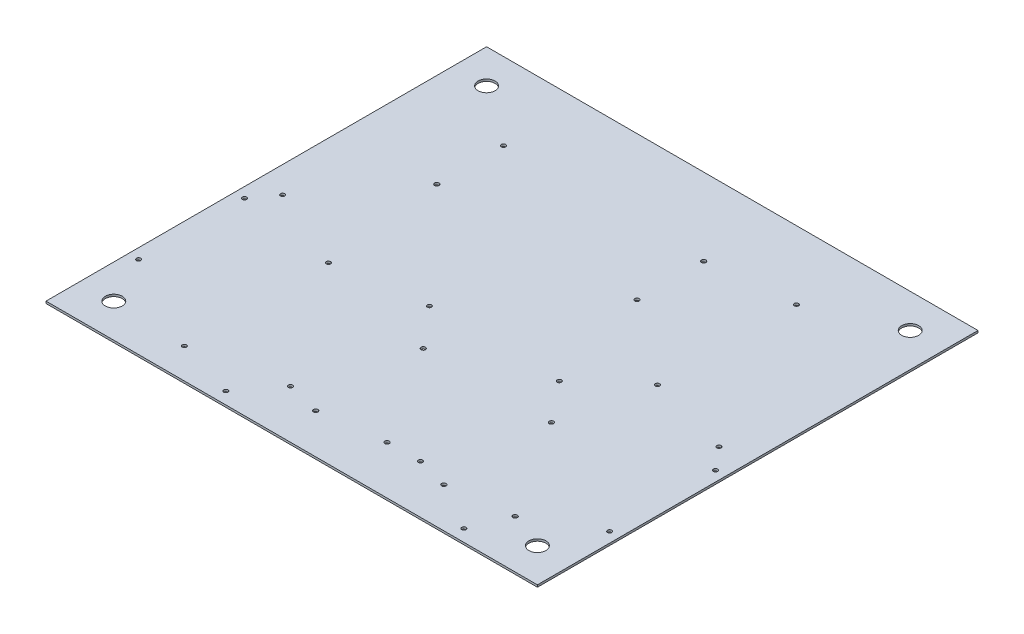
from build123d import *

# Parameters (mm, degrees)
SKETCH1_W           = 368.3
SKETCH1_H           = 330.2
BOSS_EXTRUDE1_DEPTH = 1.5875
CUT_EXTRUDE1_REACH  = 249.329
SKETCH2_R           = 6.35
CUT_EXTRUDE2_REACH  = 249.329
SKETCH3_R           = 1.665
CUT_EXTRUDE3_REACH  = 249.329
SKETCH4_R           = 1.665
SKETCH5_R           = 1.5875
CUT_EXTRUDE4_DEPTH  = 2.54


with BuildPart() as part:
    # Sketch1 → Boss-Extrude1 (new body)
    with BuildSketch(Plane(origin=(0, 0, 0), x_dir=(1, 0, 0), z_dir=(0, 1, 0))):
        Rectangle(SKETCH1_W, SKETCH1_H)
    extrude(amount=BOSS_EXTRUDE1_DEPTH)

    # Sketch2 → Cut-Extrude1 (cut, up to next)
    with BuildSketch(Plane(origin=(0, 1.5875, 0), x_dir=(1, 0, 0), z_dir=(0, 1, 0)), mode=Mode.PRIVATE) as cut_extrude1_sk1:
        with Locations((-158.75, -139.7)):
            Circle(SKETCH2_R)
    cut_extrude1_tool1 = extrude(cut_extrude1_sk1.sketch, amount=-CUT_EXTRUDE1_REACH, mode=Mode.PRIVATE) & part.part
    # Sketch2 → Cut-Extrude1 (cut, up to next)
    with BuildSketch(Plane(origin=(0, 1.5875, 0), x_dir=(1, 0, 0), z_dir=(0, 1, 0)), mode=Mode.PRIVATE) as cut_extrude1_sk2:
        with Locations((158.75, -139.7)):
            Circle(SKETCH2_R)
    cut_extrude1_tool2 = extrude(cut_extrude1_sk2.sketch, amount=-CUT_EXTRUDE1_REACH, mode=Mode.PRIVATE) & part.part
    # Sketch2 → Cut-Extrude1 (cut, up to next)
    with BuildSketch(Plane(origin=(0, 1.5875, 0), x_dir=(1, 0, 0), z_dir=(0, 1, 0)), mode=Mode.PRIVATE) as cut_extrude1_sk3:
        with Locations((-158.75, 139.7)):
            Circle(SKETCH2_R)
    cut_extrude1_tool3 = extrude(cut_extrude1_sk3.sketch, amount=-CUT_EXTRUDE1_REACH, mode=Mode.PRIVATE) & part.part
    # Sketch2 → Cut-Extrude1 (cut, up to next)
    with BuildSketch(Plane(origin=(0, 1.5875, 0), x_dir=(1, 0, 0), z_dir=(0, 1, 0)), mode=Mode.PRIVATE) as cut_extrude1_sk4:
        with Locations((158.75, 139.7)):
            Circle(SKETCH2_R)
    cut_extrude1_tool4 = extrude(cut_extrude1_sk4.sketch, amount=-CUT_EXTRUDE1_REACH, mode=Mode.PRIVATE) & part.part
    add(cut_extrude1_tool1.solids().sort_by_distance((-158.75, 1.5875, 139.7))[0], mode=Mode.SUBTRACT)
    add(cut_extrude1_tool2.solids().sort_by_distance((158.75, 1.5875, 139.7))[0], mode=Mode.SUBTRACT)
    add(cut_extrude1_tool3.solids().sort_by_distance((-158.75, 1.5875, -139.7))[0], mode=Mode.SUBTRACT)
    add(cut_extrude1_tool4.solids().sort_by_distance((158.75, 1.5875, -139.7))[0], mode=Mode.SUBTRACT)

    # Sketch3 → Cut-Extrude2 (cut, up to next)
    with BuildSketch(Plane.XZ, mode=Mode.PRIVATE) as cut_extrude2_sk1:
        with Locations((-11.909873993, 135.184369153)):
            Circle(SKETCH3_R)
    cut_extrude2_tool1 = extrude(cut_extrude2_sk1.sketch, amount=-CUT_EXTRUDE2_REACH, mode=Mode.PRIVATE) & part.part
    # Sketch3 → Cut-Extrude2 (cut, up to next)
    with BuildSketch(Plane.XZ, mode=Mode.PRIVATE) as cut_extrude2_sk2:
        with Locations((35.343407305, 128.976258797)):
            Circle(SKETCH3_R)
    cut_extrude2_tool2 = extrude(cut_extrude2_sk2.sketch, amount=-CUT_EXTRUDE2_REACH, mode=Mode.PRIVATE) & part.part
    # Sketch3 → Cut-Extrude2 (cut, up to next)
    with BuildSketch(Plane.XZ, mode=Mode.PRIVATE) as cut_extrude2_sk3:
        with Locations((-12.037588789, 54.464245503)):
            Circle(SKETCH3_R)
    cut_extrude2_tool3 = extrude(cut_extrude2_sk3.sketch, amount=-CUT_EXTRUDE2_REACH, mode=Mode.PRIVATE) & part.part
    # Sketch3 → Cut-Extrude2 (cut, up to next)
    with BuildSketch(Plane.XZ, mode=Mode.PRIVATE) as cut_extrude2_sk4:
        with Locations((84.120821947, 135.184369153)):
            Circle(SKETCH3_R)
    cut_extrude2_tool4 = extrude(cut_extrude2_sk4.sketch, amount=-CUT_EXTRUDE2_REACH, mode=Mode.PRIVATE) & part.part
    # Sketch3 → Cut-Extrude2 (cut, up to next)
    with BuildSketch(Plane.XZ, mode=Mode.PRIVATE) as cut_extrude2_sk5:
        with Locations((131.374103245, 128.976258797)):
            Circle(SKETCH3_R)
    cut_extrude2_tool5 = extrude(cut_extrude2_sk5.sketch, amount=-CUT_EXTRUDE2_REACH, mode=Mode.PRIVATE) & part.part
    # Sketch3 → Cut-Extrude2 (cut, up to next)
    with BuildSketch(Plane.XZ, mode=Mode.PRIVATE) as cut_extrude2_sk6:
        with Locations((83.993107151, 54.464245503)):
            Circle(SKETCH3_R)
    cut_extrude2_tool6 = extrude(cut_extrude2_sk6.sketch, amount=-CUT_EXTRUDE2_REACH, mode=Mode.PRIVATE) & part.part
    add(cut_extrude2_tool1.solids().sort_by_distance((-11.909874, 0, 135.184369))[0], mode=Mode.SUBTRACT)
    add(cut_extrude2_tool2.solids().sort_by_distance((35.343407, 0, 128.976259))[0], mode=Mode.SUBTRACT)
    add(cut_extrude2_tool3.solids().sort_by_distance((-12.037589, 0, 54.464246))[0], mode=Mode.SUBTRACT)
    add(cut_extrude2_tool4.solids().sort_by_distance((84.120822, 0, 135.184369))[0], mode=Mode.SUBTRACT)
    add(cut_extrude2_tool5.solids().sort_by_distance((131.374103, 0, 128.976259))[0], mode=Mode.SUBTRACT)
    add(cut_extrude2_tool6.solids().sort_by_distance((83.993107, 0, 54.464246))[0], mode=Mode.SUBTRACT)

    # Sketch4 → Cut-Extrude3 (cut, up to next)
    with BuildSketch(Plane(origin=(0, 1.5875, 0), x_dir=(1, 0, 0), z_dir=(0, 1, 0)), mode=Mode.PRIVATE) as cut_extrude3_sk1:
        with Locations((-113.55, 57.2)):
            Circle(SKETCH4_R)
    cut_extrude3_tool1 = extrude(cut_extrude3_sk1.sketch, amount=-CUT_EXTRUDE3_REACH, mode=Mode.PRIVATE) & part.part
    # Sketch4 → Cut-Extrude3 (cut, up to next)
    with BuildSketch(Plane(origin=(0, 1.5875, 0), x_dir=(1, 0, 0), z_dir=(0, 1, 0)), mode=Mode.PRIVATE) as cut_extrude3_sk2:
        with Locations((-113.55, 107.2)):
            Circle(SKETCH4_R)
    cut_extrude3_tool2 = extrude(cut_extrude3_sk2.sketch, amount=-CUT_EXTRUDE3_REACH, mode=Mode.PRIVATE) & part.part
    # Sketch4 → Cut-Extrude3 (cut, up to next)
    with BuildSketch(Plane(origin=(0, 1.5875, 0), x_dir=(1, 0, 0), z_dir=(0, 1, 0)), mode=Mode.PRIVATE) as cut_extrude3_sk3:
        with Locations((36.45, 107.2)):
            Circle(SKETCH4_R)
    cut_extrude3_tool3 = extrude(cut_extrude3_sk3.sketch, amount=-CUT_EXTRUDE3_REACH, mode=Mode.PRIVATE) & part.part
    # Sketch4 → Cut-Extrude3 (cut, up to next)
    with BuildSketch(Plane(origin=(0, 1.5875, 0), x_dir=(1, 0, 0), z_dir=(0, 1, 0)), mode=Mode.PRIVATE) as cut_extrude3_sk4:
        with Locations((36.45, 57.2)):
            Circle(SKETCH4_R)
    cut_extrude3_tool4 = extrude(cut_extrude3_sk4.sketch, amount=-CUT_EXTRUDE3_REACH, mode=Mode.PRIVATE) & part.part
    add(cut_extrude3_tool1.solids().sort_by_distance((-113.55, 1.5875, -57.2))[0], mode=Mode.SUBTRACT)
    add(cut_extrude3_tool2.solids().sort_by_distance((-113.55, 1.5875, -107.2))[0], mode=Mode.SUBTRACT)
    add(cut_extrude3_tool3.solids().sort_by_distance((36.45, 1.5875, -107.2))[0], mode=Mode.SUBTRACT)
    add(cut_extrude3_tool4.solids().sort_by_distance((36.45, 1.5875, -57.2))[0], mode=Mode.SUBTRACT)

    # Sketch5 → Cut-Extrude4 (cut)
    with BuildSketch(Plane(origin=(0, 1.5875, 0), x_dir=(1, 0, 0), z_dir=(0, 1, 0))):
        with Locations((-103.15, -142.4)):
            Circle(SKETCH5_R)
        with Locations((-103.15, -34.4)):
            Circle(SKETCH5_R)
        with Locations((-176.53, -103.365)):
            Circle(SKETCH5_R)
        with Locations((-176.53, -23.99)):
            Circle(SKETCH5_R)
        with Locations((-164.465, -7.48)):
            Circle(SKETCH5_R)
        with Locations((162.56, -7.48)):
            Circle(SKETCH5_R)
        with Locations((99.37239577, 9.665)):
            Circle(SKETCH5_R)
        with Locations((99.37239577, 113.805)):
            Circle(SKETCH5_R)
        with Locations((176.53, -103.365)):
            Circle(SKETCH5_R)
        with Locations((176.53, -23.99)):
            Circle(SKETCH5_R)
        with Locations((120.02, -156.07)):
            Circle(SKETCH5_R)
        with Locations((-58.415, -156.07)):
            Circle(SKETCH5_R)
        with Locations((-37.233747973, -128.765)):
            Circle(SKETCH5_R)
        with Locations((-37.233747973, -24.625)):
            Circle(SKETCH5_R)
        with Locations((60.124549509, -128.765)):
            Circle(SKETCH5_R)
        with Locations((60.124549509, -24.625)):
            Circle(SKETCH5_R)
    extrude(amount=-CUT_EXTRUDE4_DEPTH, mode=Mode.SUBTRACT)


solid = part.part
